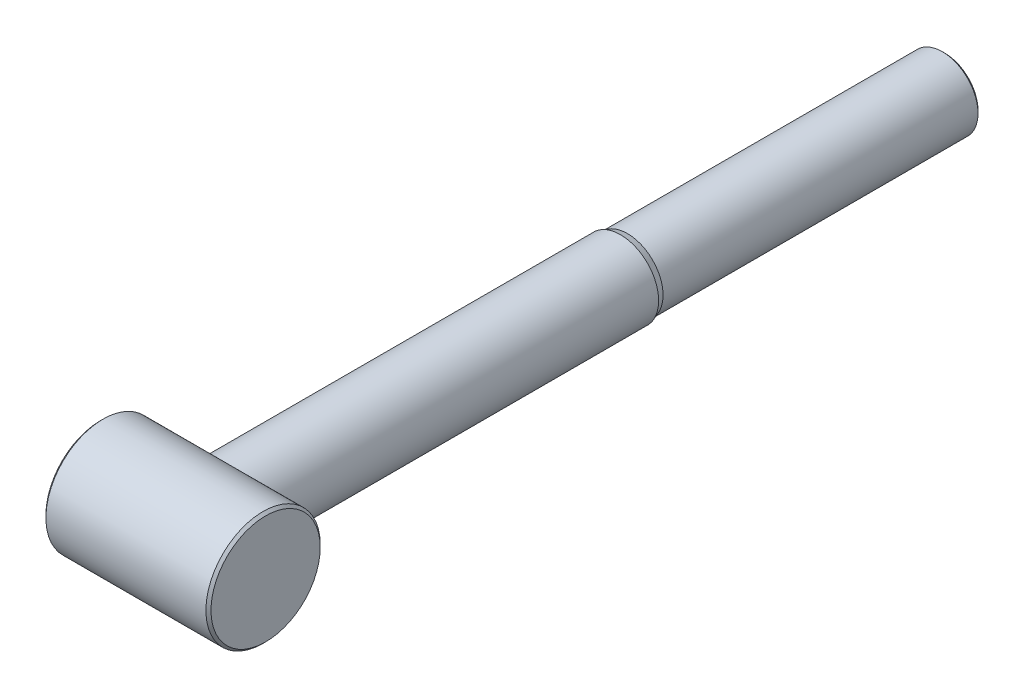
from build123d import *

# Parameters (mm, degrees)
SKETCH1_R               = 4.5
BOSS_EXTRUDE1_DEPTH     = 6.5
SKETCH2_R               = 3
BOSS_EXTRUDE2_DEPTH     = 60
CUT_EXTRUDE_THIN1_START = -25
SKETCH3_R               = 3
SKETCH3_R_2             = 2.8
CUT_EXTRUDE_THIN1_DEPTH = 25
CHAMFER1_SIZE2          = 0.2
CHAMFER1_SIZE           = 0.549495484
CHAMFER2_SIZE           = 0.2
CHAMFER3_SIZE           = 0.2


with BuildPart() as part:
    # Sketch1 → Boss-Extrude1 (new, symmetric)
    with BuildSketch(Plane(origin=(0, 0, 0), x_dir=(0, 0, -1), z_dir=(1, 0, 0))):
        with Locations(Location((0, 0, 0), (0, 0, 180))):
            Circle(SKETCH1_R)
    extrude(amount=BOSS_EXTRUDE1_DEPTH, both=True)

    # Sketch2 → Boss-Extrude2 (add)
    with BuildSketch(Plane.XY):
        Circle(SKETCH2_R)
    extrude(amount=-BOSS_EXTRUDE2_DEPTH)

    # Sketch3 → Cut-Extrude-Thin1 (cut)
    with BuildSketch(Plane(origin=(0, 0, -60), x_dir=(-1, 0, 0), z_dir=(0, 0, -1)).offset(CUT_EXTRUDE_THIN1_START)):
        Circle(SKETCH3_R)
        Circle(SKETCH3_R_2, mode=Mode.SUBTRACT)
    extrude(amount=CUT_EXTRUDE_THIN1_DEPTH, mode=Mode.SUBTRACT)

    # Chamfer1
    chamfer1_edges = [part.edges().sort_by_distance(p)[0] for p in [
        (-3, 0, -35),
    ]]
    chamfer1_side = [part.faces().sort_by_distance(p)[0] for p in [
        (-3, 0, -34.996),
    ]]
    chamfer(chamfer1_edges, length=CHAMFER1_SIZE - 0.0001, length2=CHAMFER1_SIZE2 - 0.0001, reference=chamfer1_side[0])  # a hair under: the kernel refuses the full size

    # Chamfer2
    chamfer2_edges = [part.edges().sort_by_distance(p)[0] for p in [
        (-6.5, 0, -4.5),
        (6.5, 0, -4.5),
    ]]
    chamfer(chamfer2_edges, length=CHAMFER2_SIZE)

    # Chamfer3
    chamfer3_edges = [part.edges().sort_by_distance(p)[0] for p in [
        (2.8, 0, -60),
    ]]
    chamfer(chamfer3_edges, length=CHAMFER3_SIZE)


solid = part.part
